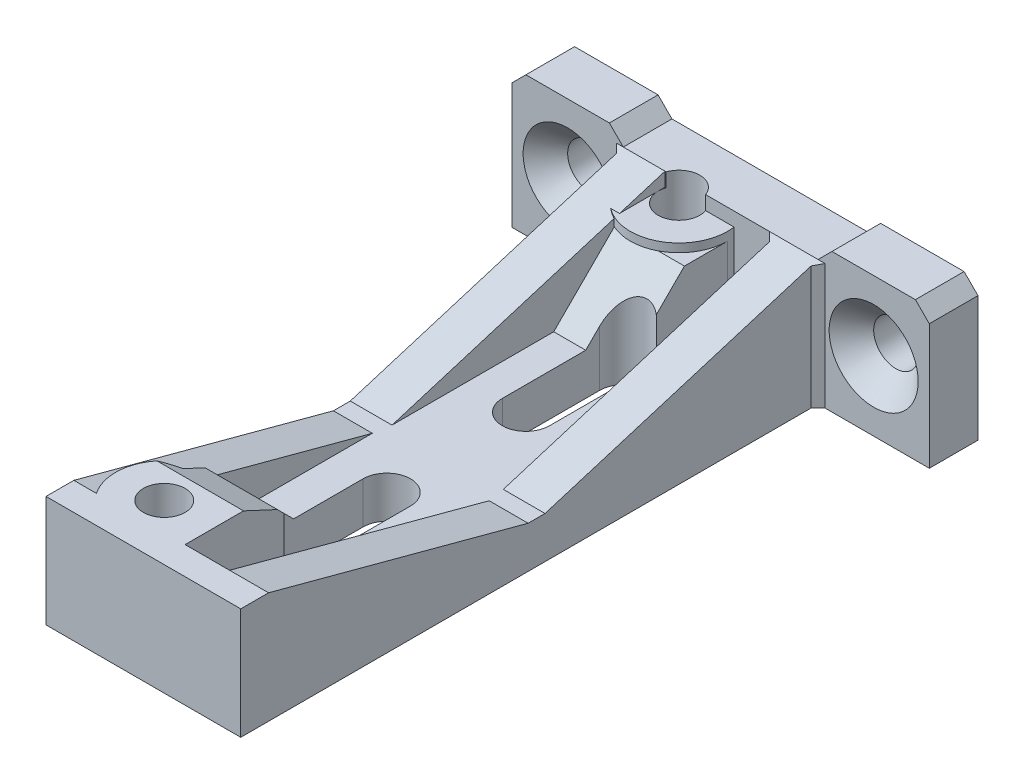
from build123d import *
from build123d.topology import SkipClean

# Parameters (mm, degrees)
SKETCH_1_W               = 14
SKETCH_1_H               = 45
EXTRUDE_1_DEPTH          = 3
SKETCH_4_W               = 8
SKETCH_4_H               = 3.5
EXTRUDE_2_DEPTH          = 10
SKETCH_10_W              = 3.5
SKETCH_10_H              = 6
EXTRUDE_3_DEPTH          = 14
CUT_EXTRUDE_1_DEPTH      = 52.078371156
CUT_EXTRUDE_1_DEPTH_BACK = 52.078371156
SKETCH_2_R               = 1.5
SKETCH_3_R               = 3.5
SKETCH_3_R_2             = 1.5
EXTRUDE_1_2_DEPTH        = 5
SKETCH_12_W              = 14
SKETCH_12_H              = 2
EXTRUDE_4_DEPTH          = 5
RIB_9_REACH              = 53.078
SKETCH_13_WALL_W         = 123.475258838
SKETCH_13_WALL_H         = 2.8
RIB_8_REACH              = 53.078
SKETCH_11_WALL_W         = 124.678564032
SKETCH_11_WALL_H         = 3
CHAMFER_3_SIZE           = 0.5
CHAMFER_4_SIZE           = 1
EXTRUDE_5_REACH          = 46.612
EXTRUDE_5_END_RADIUS     = 3.5
SKETCH_15_W              = 5.2
SKETCH_15_H              = 5
CHAMFER_5_SIZE           = 0.606199956
CHAMFER_5_SIZE_2         = 1.3
CUT_EXTRUDE_2_DEPTH      = 4
EXTRUDE_START            = 3
EXTRUDE_6_DEPTH          = 4.393800044
CUT_EXTRUDE_3_DEPTH      = 1
CHAMFER_START            = 2.8
CHAMFER_6_DEPTH          = 2.5
CHAMFER_START_2          = 5.3
CHAMFER_6_2_DEPTH        = 2.7
CHAMFER_START_3          = 3
CHAMFER_6_3_DEPTH        = 3.7
DELETE_START             = 2
DELETE_FACE_1_DEPTH      = 6


with BuildPart() as part:
    # 草图1 → Extrude 1 (new body)
    with BuildSketch(Plane(origin=(0, 0, 0), x_dir=(1, 0, 0), z_dir=(0, 1, 0))):
        with Locations((7, -22.5)):
            Rectangle(SKETCH_1_W, SKETCH_1_H)
    extrude(amount=EXTRUDE_1_DEPTH)

    # 草图4 → 凸台-拉伸2 (add)
    with BuildSketch(Plane.XZ):
        with Locations((18, 1.75)):
            Rectangle(SKETCH_4_W, SKETCH_4_H)
    extrude_2 = extrude(amount=-EXTRUDE_2_DEPTH)

    # 草图9 → 打孔尺寸(%根据)内六角花形半沉头螺钉的类型1 (revolve, cut)
    with BuildSketch(Plane(origin=(18, 5, 3.5), x_dir=(0, -1, 0), z_dir=(1, 0, 0))):
        Polygon((0, 0), (0, 5.96137699), (1.6, 5), (1.6, 1.6), (3.2, 0), align=None)
    hole_wizard_1 = revolve(axis=Axis((18, 5, 9.85), (0, 0, -1)), mode=Mode.SUBTRACT)

    # 镜向1: 凸台-拉伸2, 打孔尺寸(%根据)内六角花形半沉头螺钉的类型1 across plane
    add(extrude_2.mirror(Plane(origin=(7, 0, 0), x_dir=(0, 0, 1), z_dir=(1, 0, 0))))
    add(hole_wizard_1.mirror(Plane(origin=(7, 0, 0), x_dir=(0, 0, 1), z_dir=(1, 0, 0))), mode=Mode.SUBTRACT)

    # 草图10 → 凸台-拉伸3 (add)
    with BuildSketch(Plane.ZY.offset(-14)):
        with Locations((1.75, 6)):
            Rectangle(SKETCH_10_W, SKETCH_10_H)
    extrude(amount=EXTRUDE_3_DEPTH)

    # 草图2 → 切除-拉伸1 (cut, two sides: drawn at the far end of the back side and taken through both)
    with BuildSketch(Plane.XZ.offset(-CUT_EXTRUDE_1_DEPTH_BACK)):
        with Locations(Location((4.5, 41, 0), (0, 0, 270))):
            Circle(SKETCH_2_R)
        with Locations(Location((4.5, 4, 0), (0, 0, 270))):
            Circle(SKETCH_2_R)
    extrude(amount=CUT_EXTRUDE_1_DEPTH + CUT_EXTRUDE_1_DEPTH_BACK, mode=Mode.SUBTRACT)

    # 草图3 → Extrude 1 2 (add)
    # profile 1 of 2: a face of its own
    with SkipClean():  # the faces are left unmerged after this step: merging them gives an invalid solid
        with BuildSketch(Plane(origin=(0, 3, 0), x_dir=(1, 0, 0), z_dir=(0, 1, 0))):
            with Locations((4.5, -41)):
                Circle(SKETCH_3_R)
            with Locations((4.5, -41)):
                Circle(SKETCH_3_R_2, mode=Mode.SUBTRACT)
        # profile 2 of 2: a face of its own
        with BuildSketch(Plane(origin=(0, 3, 0), x_dir=(1, 0, 0), z_dir=(0, 1, 0))):
            with Locations((4.5, -4)):
                Circle(SKETCH_3_R)
            with Locations((4.5, -4)):
                Circle(SKETCH_3_R_2, mode=Mode.SUBTRACT)
        extrude(amount=EXTRUDE_1_2_DEPTH)

    # 草图12 → 凸台-拉伸4 (add)
    with SkipClean():  # the faces are left unmerged after this step: merging them gives an invalid solid
        with BuildSketch(Plane(origin=(0, 3, 0), x_dir=(1, 0, 0), z_dir=(0, 1, 0))):
            with Locations((7, -44)):
                Rectangle(SKETCH_12_W, SKETCH_12_H)
        extrude(amount=EXTRUDE_4_DEPTH)

    # 草图13 wall → 筋9 (add, up to next)
    with BuildSketch(Plane(origin=(14, 5.5, 33.669872981), x_dir=(0, -0.258819045101, -0.96592582629), z_dir=(0, 0.96592582629, -0.258819045101)), mode=Mode.PRIVATE) as rib_9_sk1:
        with Locations((0, 1.4)):
            Rectangle(SKETCH_13_WALL_W, SKETCH_13_WALL_H)
    rib_9_tool1 = extrude(rib_9_sk1.sketch, amount=-RIB_9_REACH, mode=Mode.PRIVATE) - part.part
    rib_9 = rib_9_tool1.solids().sort_by_distance((14, 5.5, 33.669872981))[0]
    add(rib_9)

    # 草图11 wall → 筋8 (add, up to next)
    with BuildSketch(Plane(origin=(14, 6, 13.312557855), x_dir=(0, -0.292371704721, 0.956304755963), z_dir=(0, -0.956304755963, -0.292371704721)), mode=Mode.PRIVATE) as rib_8_sk1:
        with Locations((0, 1.5)):
            Rectangle(SKETCH_11_WALL_W, SKETCH_11_WALL_H)
    rib_8_tool1 = extrude(rib_8_sk1.sketch, amount=RIB_8_REACH, mode=Mode.PRIVATE) - part.part
    rib_8 = rib_8_tool1.solids().sort_by_distance((14, 6, 13.312557855))[0]
    add(rib_8)

    # 镜向2: 筋9, 筋8 across plane
    with SkipClean():  # the faces are left unmerged after this step: merging them gives an invalid solid
        add(rib_9.mirror(Plane(origin=(7, 0, 0), x_dir=(0, 0, 1), z_dir=(1, 0, 0))))
        add(rib_8.mirror(Plane(origin=(7, 0, 0), x_dir=(0, 0, 1), z_dir=(1, 0, 0))))

    # 倒角3
    # the kernel refuses this chamfer: 0.5 mm, written as the material it adds along each edge
    with BuildSketch(Plane(origin=(14, 3, 3.5), x_dir=(1, 0, 0), z_dir=(0, 1, 0))) as chamfer_3_piece_1_section:
        Polygon((CHAMFER_3_SIZE, 0), (0, -CHAMFER_3_SIZE), (0, 0), align=None)
    chamfer_3_piece_1 = extrude(amount=7.285841494, mode=Mode.PRIVATE)
    chamfer_3_piece_1 = split(chamfer_3_piece_1, bisect_by=Plane(origin=(14, 8.487112718, 5.17757871), z_dir=(0, -0.956304755963518, -0.29237170472115837)), keep=Keep.TOP, mode=Mode.PRIVATE)
    add(chamfer_3_piece_1)
    with BuildSketch(Plane(origin=(11, 10.285841494, 3.5), x_dir=(-1, 0, 0), z_dir=(0, -1, 0))) as chamfer_3_piece_2_section:
        Polygon((CHAMFER_3_SIZE, 0), (0, -CHAMFER_3_SIZE), (0, 0), align=None)
    chamfer_3_piece_2 = extrude(amount=8.571682988, mode=Mode.PRIVATE)
    chamfer_3_piece_2 = split(chamfer_3_piece_2, bisect_by=Plane(origin=(11, 9.109915291, 3.140483281), z_dir=(0, -0.956304755963518, -0.29237170472115837)), keep=Keep.TOP, mode=Mode.PRIVATE)
    add(chamfer_3_piece_2)
    with BuildSketch(Plane(origin=(0, 3, 3.5), x_dir=(0, 0, 1), z_dir=(0, 1, 0))) as chamfer_3_piece_3_section:
        Polygon((CHAMFER_3_SIZE, 0), (0, -CHAMFER_3_SIZE), (0, 0), align=None)
    chamfer_3_piece_3 = extrude(amount=7.285841494, mode=Mode.PRIVATE)
    chamfer_3_piece_3 = split(chamfer_3_piece_3, bisect_by=Plane(origin=(0, 8.487112718, 5.17757871), z_dir=(0, -0.956304755963518, -0.29237170472115837)), keep=Keep.TOP, mode=Mode.PRIVATE)
    add(chamfer_3_piece_3)
    with BuildSketch(Plane(origin=(0, 0, 3.5), x_dir=(0, 0, 1), z_dir=(0, 1, 0))) as chamfer_3_piece_4:
        Polygon((CHAMFER_3_SIZE, 0), (0, -CHAMFER_3_SIZE), (0, 0), align=None)
    extrude(amount=3)
    with BuildSketch(Plane(origin=(14, 0, 3.5), x_dir=(0, 0, 1), z_dir=(0, 1, 0))) as chamfer_3_piece_5:
        Polygon((CHAMFER_3_SIZE, 0), (0, CHAMFER_3_SIZE), (0, 0), align=None)
    extrude(amount=3)

    # 倒角4
    chamfer_4_edges = [part.edges().sort_by_distance(p)[0] for p in [
        (-8, 10, 1.75),
        (0, 10, 1.75),
        (14, 10, 1.75),
        (22, 10, 1.75),
    ]]
    chamfer(chamfer_4_edges, length=CHAMFER_4_SIZE - 0.0001)  # a hair under: the kernel refuses the full size

    # 凸台-拉伸5: up to this cylinder (the profile starts outside it)
    extrude_5_end = Plane(origin=(4.5, 5.5, 41), z_dir=(0, -1, 0)) * Cylinder(EXTRUDE_5_END_RADIUS, 101.224, mode=Mode.PRIVATE)
    # 草图15 → 凸台-拉伸5 (add, up to the surface)
    with BuildSketch(Plane(origin=(0, 0, 37.5), x_dir=(-1, 0, 0), z_dir=(0, 0, -1)), mode=Mode.PRIVATE) as extrude_5_sk1:
        with Locations((-5.4, 5.5)):
            Rectangle(SKETCH_15_W, SKETCH_15_H)
    extrude_5_tool1 = extrude(extrude_5_sk1.sketch, amount=-EXTRUDE_5_REACH, mode=Mode.PRIVATE) - extrude_5_end
    add(extrude_5_tool1.solids().sort_by_distance((5.4, 5.5, 37.5))[0])
    add(extrude_5_tool1.solids().sort_by_distance((5.4, 5.5, 37.5))[1])

    # 倒角5
    # the kernel refuses this chamfer: 1.3, 0.606199956 mm, written as the material it takes off along each edge
    with BuildSketch(Plane(origin=(4.5, 8, 37.5), x_dir=(0, -1, 0), z_dir=(1, 0, 0))) as chamfer_5_piece_1:
        Polygon((CHAMFER_5_SIZE, 0), (0, -CHAMFER_5_SIZE_2), (0, 0), align=None)
    extrude(amount=6.868268113, mode=Mode.SUBTRACT)
    with BuildSketch(Plane(origin=(-0.568268113, 8, 37.5), x_dir=(0, -1, 0), z_dir=(1, 0, 0))) as chamfer_5_piece_2:
        Polygon((CHAMFER_5_SIZE, 0), (0, -CHAMFER_5_SIZE_2), (0, 0), align=None)
    extrude(amount=5.068268113, mode=Mode.SUBTRACT)

    # 草图14 → 切除-拉伸2 (cut)
    with BuildSketch(Plane.XZ):
        with BuildLine():
            Line((8.7, 34.5), (8.7, 27.5))
            ThreePointArc((8.7, 27.5), (7, 25.8), (5.3, 27.5))
            Line((5.3, 27.5), (5.3, 34.5))
            ThreePointArc((5.3, 34.5), (7, 36.2), (8.7, 34.5))
        make_face()
        with BuildLine():
            Line((8.7, 10.5), (8.7, 17.5))
            ThreePointArc((8.7, 17.5), (7, 19.2), (5.3, 17.5))
            Line((5.3, 17.5), (5.3, 10.5))
            ThreePointArc((5.3, 10.5), (7, 8.8), (8.7, 10.5))
        make_face()
    extrude(amount=-CUT_EXTRUDE_2_DEPTH, mode=Mode.SUBTRACT)

    # 凸台-拉伸6: read off the stored shape, not the designer's step
    # 凸台-拉伸6 outline → 凸台-拉伸6 (add)
    with BuildSketch(Plane(origin=(0, 0, 0), x_dir=(1, 0, 0), z_dir=(0, 1, 0)).offset(EXTRUDE_START)):
        with BuildLine():
            Line((4.5, -7.5), (8, -7.5))
            Line((8, -7.5), (8, -4))
            ThreePointArc((8, -4), (6.974873734, -6.474873734), (4.5, -7.5))
        make_face()
        with BuildLine():
            Line((3, -7.5), (4.5, -7.5))
            ThreePointArc((4.5, -7.5), (3.731225589, -7.414525722), (3, -7.16227766))
            Line((3, -7.16227766), (3, -7.5))
        make_face()
    extrude(amount=EXTRUDE_6_DEPTH)

    # 草图21 → 切除-拉伸3 (cut)
    with BuildSketch(Plane.XY.offset(7.5)):
        Polygon((3, 7.393800044), (3, 3), (8, 3), (8, 7.393800044), (4.5, 7.393800044), align=None)
    extrude(amount=-CUT_EXTRUDE_3_DEPTH, mode=Mode.SUBTRACT)

    # 倒角6: read off the stored shape, not the designer's step
    # 倒角6 outline → 倒角6 (add)
    with BuildSketch(Plane.YZ.offset(CHAMFER_START)):
        Polygon((3, 6.5), (7.393800044, 6.5), (7.393800044, 7.106199956), (3, 11.5), align=None)
        Polygon((3, 37.5), (3, 32.5), (6.864139677, 36.364139677), (7.393800044, 37.5), align=None)
    extrude(amount=CHAMFER_6_DEPTH)

    # Chamfer 6 2 outline → Chamfer 6 2 (add)
    with BuildSketch(Plane.YZ.offset(CHAMFER_START_2)):
        Polygon((3, 6.5), (7.393800044, 6.5), (7.393800044, 7.106199956), (3, 11.5), align=None)
        Polygon((3, 37.5), (3, 32.5), (6.864139677, 36.364139677), (7.393800044, 37.5), align=None)
    extrude(amount=CHAMFER_6_2_DEPTH)

    # Chamfer 6 3 outline → Chamfer 6 3 (cut)
    with BuildSketch(Plane(origin=(0, 0, 0), x_dir=(1, 0, 0), z_dir=(0, 1, 0)).offset(CHAMFER_START_3)):
        with BuildLine():
            ThreePointArc((8, -9.125227292), (6.228637569, -8.985074259), (5.3, -10.5))
            Line((5.3, -10.5), (5.3, -34.5))
            ThreePointArc((5.3, -34.5), (6.228637569, -36.014925741), (8, -35.874772708))
            Line((8, -35.874772708), (8, -9.125227292))
        make_face()
    extrude(amount=CHAMFER_6_3_DEPTH, mode=Mode.SUBTRACT)

    # Delete Face 1: read off the stored shape, not the designer's step
    # Delete Face 1 outline → Delete Face 1 (add)
    with BuildSketch(Plane(origin=(0, 0, 0), x_dir=(1, 0, 0), z_dir=(0, 1, 0)).offset(DELETE_START)):
        with BuildLine():
            Line((7.372281323, -43), (8, -43))
            Line((8, -43), (8, -41))
            ThreePointArc((8, -41), (7.839385021, -42.048097173), (7.372281323, -43))
        make_face()
    extrude(amount=DELETE_FACE_1_DEPTH)


solid = part.part
